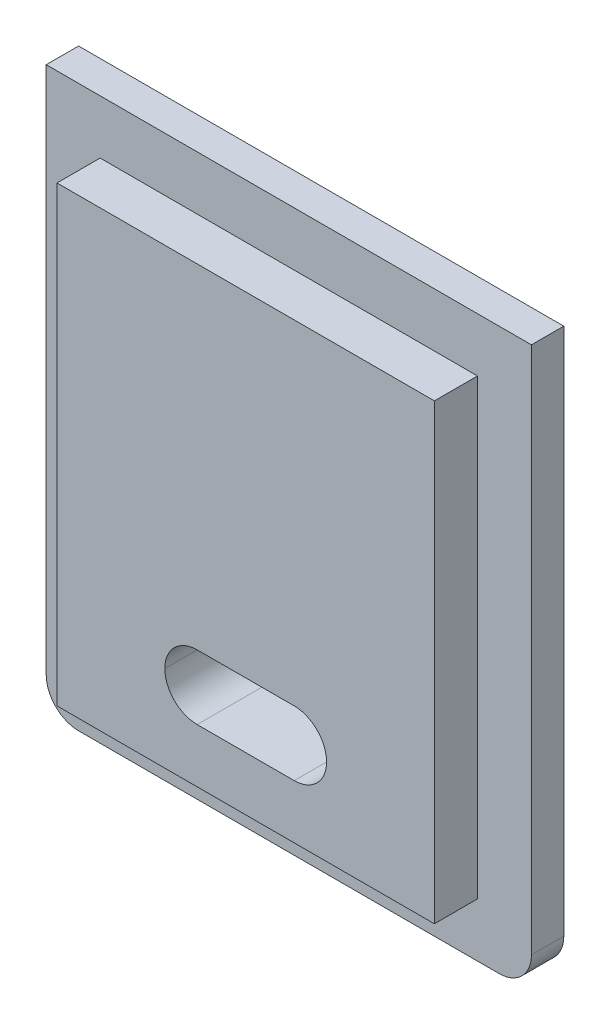
from build123d import *

# Parameters (mm, degrees)
SKETCH1_W           = 45
SKETCH1_H           = 52
BOSS_EXTRUDE1_DEPTH = 3
SKETCH2_W           = 35
SKETCH2_H           = 42
BOSS_EXTRUDE2_DEPTH = 4
SKETCH3_W           = 15
SKETCH3_H           = 6
CUT_EXTRUDE1_DEPTH  = 70.123078635
FILLET1_R           = 3


with BuildPart() as part:
    # Sketch1 → Boss-Extrude1 (new body)
    with BuildSketch(Plane.XY):
        with Locations((22.5, 26)):
            Rectangle(SKETCH1_W, SKETCH1_H)
    extrude(amount=BOSS_EXTRUDE1_DEPTH)

    # Sketch2 → Boss-Extrude2 (add)
    with BuildSketch(Plane.XY.offset(3)):
        with Locations((22.5, 26)):
            Rectangle(SKETCH2_W, SKETCH2_H)
    extrude(amount=BOSS_EXTRUDE2_DEPTH)

    # Sketch3 → Cut-Extrude1 (cut, through all)
    with BuildSketch(Plane.XY.offset(7)):
        with Locations((22.5, 13)):
            Rectangle(SKETCH3_W, SKETCH3_H)
    extrude(amount=-CUT_EXTRUDE1_DEPTH, mode=Mode.SUBTRACT)

    # Fillet1
    fillet1_edges = [part.edges().sort_by_distance(p)[0] for p in [
        (30, 10, 3.5),
        (15, 10, 3.5),
        (30, 16, 3.5),
        (15, 16, 3.5),
        (45, 0, 1.5),
        (0, 0, 1.5),
    ]]
    fillet(fillet1_edges, radius=FILLET1_R - 0.0001)  # a hair under: the kernel refuses the full size


solid = part.part
